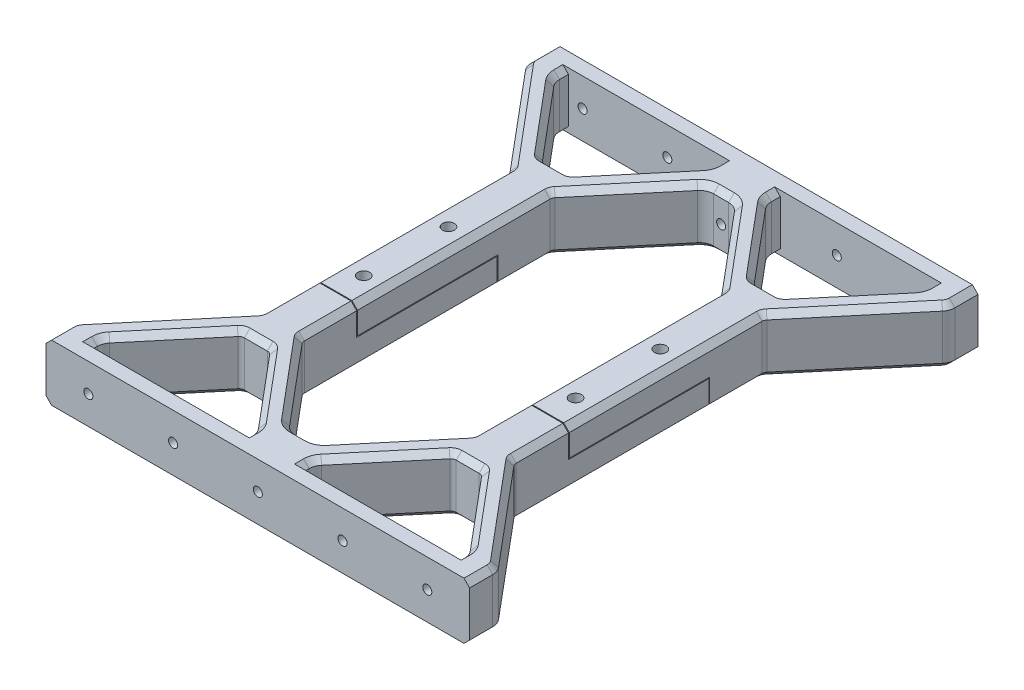
from build123d import *

# Parameters (mm, degrees)
SKETCH1_R               = 2.1
BOSS_EXTRUDE1_DEPTH     = 10
FILLET1_R               = 2
FILLET2_R               = 5
CUT_EXTRUDE1_REACH      = 209.58
CUT_EXTRUDE1_START      = 90
SKETCH3_R               = 1.6
CHAMFER1_SIZE           = 2
CUT_EXTRUDE2_DEPTH      = 118.579760163
CUT_EXTRUDE2_DEPTH_BACK = 118.579760163


with BuildPart() as part:
    # Sketch1 → Boss-Extrude1 (new, symmetric)
    with BuildSketch(Plane(origin=(0, 0, 0), x_dir=(1, 0, 0), z_dir=(0, 1, 0))):
        Polygon((0, -74.041232037), (0, -90), (75, -90), (75, -80), (45, -44.247392222), (45, 0), (30, 0), (30, -44.247392222), (5, -74.041232037), align=None)
        Polygon((42.5, -53.185544167), (65, -80), (65, -85), (10, -85), (10, -80), (32.5, -53.185544167), align=None, mode=Mode.SUBTRACT)
        with Locations((37.5, -15)):
            Circle(SKETCH1_R, mode=Mode.SUBTRACT)
    extrude(amount=BOSS_EXTRUDE1_DEPTH, both=True)

    # Fillet1
    fillet1_edges = [part.edges().sort_by_distance(p)[0] for p in [
        (30, 0, 44.247392222),
        (45, 0, 44.247392222),
        (42.5, 0, 53.185544167),
        (32.5, 0, 53.185544167),
    ]]
    fillet(fillet1_edges, radius=FILLET1_R)

    # Fillet2
    fillet2_edges = [part.edges().sort_by_distance(p)[0] for p in [
        (75, 0, 80),
        (65, 0, 80),
        (5, 0, 74.041232037),
        (10, 0, 80),
    ]]
    fillet(fillet2_edges, radius=FILLET2_R)

    # Mirror1: part across plane


with BuildPart() as part_1:
    add(part.part)
    add(part.part.mirror(Plane(origin=(0, 0, 0), x_dir=(0, 0, 1), z_dir=(1, 0, 0))))

    # Sketch3 → Cut-Extrude1 (cut, up to next)
    with BuildSketch(Plane.XY.offset(CUT_EXTRUDE1_START), mode=Mode.PRIVATE) as cut_extrude1_sk1:
        Circle(SKETCH3_R)
    cut_extrude1_tool1 = extrude(cut_extrude1_sk1.sketch, amount=-CUT_EXTRUDE1_REACH, mode=Mode.PRIVATE) & part_1.part
    # Sketch3 → Cut-Extrude1 (cut, up to next)
    with BuildSketch(Plane.XY.offset(CUT_EXTRUDE1_START), mode=Mode.PRIVATE) as cut_extrude1_sk2:
        with Locations((30, 0)):
            Circle(SKETCH3_R)
    cut_extrude1_tool2 = extrude(cut_extrude1_sk2.sketch, amount=-CUT_EXTRUDE1_REACH, mode=Mode.PRIVATE) & part_1.part
    # Sketch3 → Cut-Extrude1 (cut, up to next)
    with BuildSketch(Plane.XY.offset(CUT_EXTRUDE1_START), mode=Mode.PRIVATE) as cut_extrude1_sk3:
        with Locations((60, 0)):
            Circle(SKETCH3_R)
    cut_extrude1_tool3 = extrude(cut_extrude1_sk3.sketch, amount=-CUT_EXTRUDE1_REACH, mode=Mode.PRIVATE) & part_1.part
    # Sketch3 → Cut-Extrude1 (cut, up to next)
    with BuildSketch(Plane.XY.offset(CUT_EXTRUDE1_START), mode=Mode.PRIVATE) as cut_extrude1_sk4:
        with Locations((-30, 0)):
            Circle(SKETCH3_R)
    cut_extrude1_tool4 = extrude(cut_extrude1_sk4.sketch, amount=-CUT_EXTRUDE1_REACH, mode=Mode.PRIVATE) & part_1.part
    # Sketch3 → Cut-Extrude1 (cut, up to next)
    with BuildSketch(Plane.XY.offset(CUT_EXTRUDE1_START), mode=Mode.PRIVATE) as cut_extrude1_sk5:
        with Locations((-60, 0)):
            Circle(SKETCH3_R)
    cut_extrude1_tool5 = extrude(cut_extrude1_sk5.sketch, amount=-CUT_EXTRUDE1_REACH, mode=Mode.PRIVATE) & part_1.part
    add(cut_extrude1_tool1.solids().sort_by_distance((0, 0, 90))[0], mode=Mode.SUBTRACT)
    add(cut_extrude1_tool2.solids().sort_by_distance((30, 0, 90))[0], mode=Mode.SUBTRACT)
    add(cut_extrude1_tool3.solids().sort_by_distance((60, 0, 90))[0], mode=Mode.SUBTRACT)
    add(cut_extrude1_tool4.solids().sort_by_distance((-30, 0, 90))[0], mode=Mode.SUBTRACT)
    add(cut_extrude1_tool5.solids().sort_by_distance((-60, 0, 90))[0], mode=Mode.SUBTRACT)

    # Mirror2: part across plane


with BuildPart() as part_2:
    add(part_1.part)
    add(part_1.part.mirror(Plane.XY))

    # Chamfer1
    chamfer1_edges = [part_2.edges().sort_by_distance(p)[0] for p in [
        (-10, -10, -83.409925586),
        (-65, -10, -83.409925586),
        (-10.301536896, -10, -80.109750455),
        (-64.698463104, -10, -80.109750455),
        (-21.535152107, -10, -66.252941035),
        (-53.464847893, -10, -66.252941035),
        (-32.587378793, -10, -53.372928593),
        (-42.412621207, -10, -53.372928593),
        (-37.5, -10, -53.185544167),
        (10, -10, -83.409925586),
        (65, -10, -83.409925586),
        (10.301536896, -10, -80.109750455),
        (64.698463104, -10, -80.109750455),
        (21.535152107, -10, -66.252941035),
        (53.464847893, -10, -66.252941035),
        (32.587378793, -10, -53.372928593),
        (42.412621207, -10, -53.372928593),
        (37.5, -10, -53.185544167),
        (10, -10, 83.409925586),
        (65, -10, 83.409925586),
        (10.301536896, -10, 80.109750455),
        (64.698463104, -10, 80.109750455),
        (21.535152107, -10, 66.252941035),
        (53.464847893, -10, 66.252941035),
        (32.587378793, -10, 53.372928593),
        (42.412621207, -10, 53.372928593),
        (37.5, -10, 53.185544167),
        (-10, -10, 83.409925586),
        (-65, -10, 83.409925586),
        (-10.301536896, -10, 80.109750455),
        (-64.698463104, -10, 80.109750455),
        (-21.535152107, -10, 66.252941035),
        (-53.464847893, -10, 66.252941035),
        (-32.587378793, -10, 53.372928593),
        (-42.412621207, -10, 53.372928593),
        (-37.5, -10, 53.185544167),
        (75, 10, 85.909925586),
        (75, 10, -85.909925586),
        (74.698463104, 10, 80.109750455),
        (74.698463104, 10, -80.109750455),
        (59.649066665, 10, 61.705470048),
        (59.649066665, 10, -61.705470048),
        (45.120614758, 10, 44.20349204),
        (45.120614758, 10, -44.20349204),
        (45, 10, 0),
        (10, 10, 83.409925586),
        (65, 10, 83.409925586),
        (10.301536896, 10, 80.109750455),
        (64.698463104, 10, 80.109750455),
        (21.535152107, 10, 66.252941035),
        (53.464847893, 10, 66.252941035),
        (32.587378793, 10, 53.372928593),
        (42.412621207, 10, 53.372928593),
        (37.5, 10, 53.185544167),
        (-10, 10, 83.409925586),
        (-65, 10, 83.409925586),
        (-10.301536896, 10, 80.109750455),
        (-64.698463104, 10, 80.109750455),
        (-21.535152107, 10, 66.252941035),
        (-53.464847893, 10, 66.252941035),
        (-32.587378793, 10, 53.372928593),
        (-42.412621207, 10, 53.372928593),
        (-37.5, 10, 53.185544167),
        (10, 10, -83.409925586),
        (65, 10, -83.409925586),
        (10.301536896, 10, -80.109750455),
        (64.698463104, 10, -80.109750455),
        (21.535152107, 10, -66.252941035),
        (53.464847893, 10, -66.252941035),
        (32.587378793, 10, -53.372928593),
        (42.412621207, 10, -53.372928593),
        (37.5, 10, -53.185544167),
        (-10, 10, -83.409925586),
        (-65, 10, -83.409925586),
        (-10.301536896, 10, -80.109750455),
        (-64.698463104, 10, -80.109750455),
        (-21.535152107, 10, -66.252941035),
        (-53.464847893, 10, -66.252941035),
        (-32.587378793, 10, -53.372928593),
        (-42.412621207, 10, -53.372928593),
        (-37.5, 10, -53.185544167),
        (30, 10, 0),
        (29.879385242, 10, 44.20349204),
        (29.879385242, 10, -44.20349204),
        (18.015386406, 10, 58.530098529),
        (18.015386406, 10, -58.530098529),
        (4.781553018, 10, 73.572770972),
        (4.781553018, 10, -73.572770972),
        (0, 10, 74.041232037),
        (0, 10, -74.041232037),
        (-4.781553018, 10, 73.572770972),
        (-4.781553018, 10, -73.572770972),
        (-18.015386406, 10, 58.530098529),
        (-18.015386406, 10, -58.530098529),
        (-29.879385242, 10, 44.20349204),
        (-29.879385242, 10, -44.20349204),
        (-30, 10, 0),
        (-75, 10, 85.909925586),
        (-75, 10, -85.909925586),
        (-74.698463104, 10, 80.109750455),
        (-74.698463104, 10, -80.109750455),
        (-59.649066665, 10, 61.705470048),
        (-59.649066665, 10, -61.705470048),
        (-45.120614758, 10, 44.20349204),
        (-45.120614758, 10, -44.20349204),
        (-45, 10, 0),
        (-75, -10, 85.909925586),
        (-75, -10, -85.909925586),
        (-74.698463104, -10, 80.109750455),
        (-74.698463104, -10, -80.109750455),
        (-59.649066665, -10, 61.705470048),
        (-59.649066665, -10, -61.705470048),
        (-45.120614758, -10, 44.20349204),
        (-45.120614758, -10, -44.20349204),
        (-45, -10, 0),
        (-30, -10, 0),
        (-29.879385242, -10, 44.20349204),
        (-29.879385242, -10, -44.20349204),
        (-18.015386406, -10, 58.530098529),
        (-18.015386406, -10, -58.530098529),
        (-4.781553018, -10, 73.572770972),
        (-4.781553018, -10, -73.572770972),
        (0, -10, 74.041232037),
        (0, -10, -74.041232037),
        (4.781553018, -10, 73.572770972),
        (4.781553018, -10, -73.572770972),
        (18.015386406, -10, 58.530098529),
        (18.015386406, -10, -58.530098529),
        (29.879385242, -10, 44.20349204),
        (29.879385242, -10, -44.20349204),
        (30, -10, 0),
        (75, -10, 85.909925586),
        (75, -10, -85.909925586),
        (74.698463104, -10, 80.109750455),
        (74.698463104, -10, -80.109750455),
        (59.649066665, -10, 61.705470048),
        (59.649066665, -10, -61.705470048),
        (45.120614758, -10, 44.20349204),
        (45.120614758, -10, -44.20349204),
        (45, -10, 0),
    ]]
    chamfer(chamfer1_edges, length=CHAMFER1_SIZE)

    # Sketch4 → Cut-Extrude2 (cut, two sides: drawn at the far end of the back side and taken through both)
    with BuildSketch(Plane(origin=(0, 0, 0), x_dir=(0, 0, -1), z_dir=(1, 0, 0)).offset(-CUT_EXTRUDE2_DEPTH_BACK)):
        Polygon((25, -10), (25, 0.15), (-24.7, 0.15), (-24.7, 10), (-25, 10), (-25, -0.15), (24.7, -0.15), (24.7, -10), align=None)
    extrude(amount=CUT_EXTRUDE2_DEPTH + CUT_EXTRUDE2_DEPTH_BACK, mode=Mode.SUBTRACT)


with BuildPart() as cut_extrude2_piece_1:
    # of the separate pieces the step leaves, piece 1, a body of its own (cut_extrude2_pieces)
    add(part_2.part.solids().sort_by_distance((-73, 10, -90))[0])


with BuildPart() as cut_extrude2_piece_2:
    # of the separate pieces the step leaves, piece 2, a body of its own (cut_extrude2_pieces)
    add(part_2.part.solids().sort_by_distance((6.498683925, 8, 72.255170085))[0])


solid = Compound([cut_extrude2_piece_1.part, cut_extrude2_piece_2.part])
